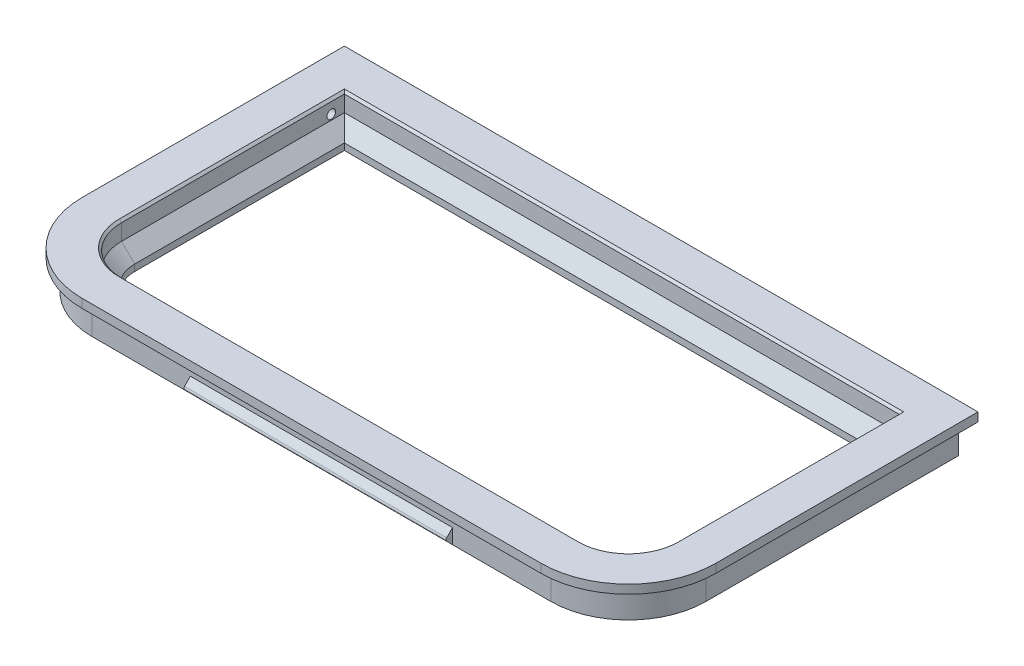
from build123d import *

# Parameters (mm, degrees)
SKETCH_1_W          = 145
SKETCH_1_H          = 80
EXTRUDE_1_DEPTH     = 2
FILLET_1_R          = 20
CUT_EXTRUDE_1_DEPTH = 2
EXTRUDE_2_DEPTH     = 2
EXTRUDE_4_DEPTH     = 7.5
EXTRUDE_5_DEPTH     = 30
FILLET_2_R          = 0.5
EXTRUDE_6_DEPTH     = 4.7
EXTRUDE_START       = -1.5
EXTRUDE_9_DEPTH     = 1.5
CHAMFER_2_SIZE      = 3
SKETCH_11_R         = 1
CUT_EXTRUDE_2_DEPTH = 149.399637803
CHAMFER_3_SIZE      = 0.5
EXTRUDE_10_DEPTH    = 60


with BuildPart() as part:
    # Эскиз1 → Бобышка-Вытянуть1 (new body)
    with BuildSketch(Plane(origin=(0, 0, 0), x_dir=(1, 0, 0), z_dir=(0, 1, 0))):
        Rectangle(SKETCH_1_W, SKETCH_1_H)
    extrude(amount=EXTRUDE_1_DEPTH)

    # Скругление1
    fillet_1_edges = [part.edges().sort_by_distance(p)[0] for p in [
        (72.5, 1, 40),
        (-72.5, 1, 40),
    ]]
    fillet(fillet_1_edges, radius=FILLET_1_R)

    # Эскиз2 → Вырез-Вытянуть1 (cut)
    with BuildSketch(Plane(origin=(0, 2, 0), x_dir=(1, 0, 0), z_dir=(0, 1, 0))):
        with BuildLine():
            Line((-63.5, 31), (-63.5, -20))
            ThreePointArc((-63.5, -20), (-60.278174593, -27.778174593), (-52.5, -31))
            Line((-52.5, -31), (52.5, -31))
            ThreePointArc((52.5, -31), (60.278174593, -27.778174593), (63.5, -20))
            Line((63.5, -20), (63.5, 31))
            Line((63.5, 31), (-63.5, 31))
        make_face()
    extrude(amount=-CUT_EXTRUDE_1_DEPTH, mode=Mode.SUBTRACT)

    # Эскиз3 → Бобышка-Вытянуть2 (add)
    with BuildSketch(Plane.XZ):
        with BuildLine():
            Line((70.25, -37.75), (70.25, 20))
            ThreePointArc((70.25, 20), (65.051145366, 32.551145366), (52.5, 37.75))
            Line((52.5, 37.75), (-52.5, 37.75))
            ThreePointArc((-52.5, 37.75), (-65.051145366, 32.551145366), (-70.25, 20))
            Line((-70.25, 20), (-70.25, -37.75))
            Line((-70.25, -37.75), (70.25, -37.75))
        make_face()
        with BuildLine():
            Line((-63.5, -31), (-63.5, 20))
            ThreePointArc((-63.5, 20), (-60.278174593, 27.778174593), (-52.5, 31))
            Line((-52.5, 31), (52.5, 31))
            ThreePointArc((52.5, 31), (60.278174593, 27.778174593), (63.5, 20))
            Line((63.5, 20), (63.5, -31))
            Line((63.5, -31), (-63.5, -31))
        make_face(mode=Mode.SUBTRACT)
    extrude(amount=EXTRUDE_2_DEPTH)

    # Эскиз5 → Бобышка-Вытянуть4 (add, symmetric)
    with BuildSketch(Plane(origin=(0, 0, 0), x_dir=(0, 0, -1), z_dir=(1, 0, 0))):
        Polygon((37.75, -2), (31, -2), (31, -6.7), (37.75, -6.7), (39.45, -5), (37.75, -3.3), align=None)
        Polygon((-31, -2), (-31, -6.7), (-37.75, -6.7), (-39.45, -5), (-37.75, -3.3), (-37.75, -2), align=None)
    extrude(amount=EXTRUDE_4_DEPTH, both=True)

    # Эскиз6 → Бобышка-Вытянуть5 (add, symmetric)
    with BuildSketch(Plane(origin=(0, 0, 0), x_dir=(0, 0, -1), z_dir=(1, 0, 0))):
        Polygon((-39.45, -5), (-37.75, -6.7), (-31, -6.7), (-31, -2), (-37.75, -2), (-37.75, -3.3), align=None)
    extrude(amount=EXTRUDE_5_DEPTH, both=True)

    # Скругление2
    fillet_2_edges = [part.edges().sort_by_distance(p)[0] for p in [
        (0, -5, 39.45),
        (0, -5, -39.45),
    ]]
    fillet(fillet_2_edges, radius=FILLET_2_R)

    # Эскиз7 → Бобышка-Вытянуть6 (add)
    with BuildSketch(Plane.XZ.offset(2)):
        with BuildLine():
            Line((-52.5, 31), (-30, 31))
            Line((-30, 31), (-30, 37.75))
            Line((-30, 37.75), (-52.5, 37.75))
            ThreePointArc((-52.5, 37.75), (-65.051145366, 32.551145366), (-70.25, 20))
            Line((-70.25, 20), (-70.25, -37.75))
            Line((-70.25, -37.75), (-7.5, -37.75))
            Line((-7.5, -37.75), (-7.5, -31))
            Line((-7.5, -31), (-63.5, -31))
            Line((-63.5, -31), (-63.5, 20))
            ThreePointArc((-63.5, 20), (-60.278174593, 27.778174593), (-52.5, 31))
        make_face()
        with BuildLine():
            Line((30, 31), (52.5, 31))
            ThreePointArc((52.5, 31), (60.278174593, 27.778174593), (63.5, 20))
            Line((63.5, 20), (63.5, -31))
            Line((63.5, -31), (7.5, -31))
            Line((7.5, -31), (7.5, -37.75))
            Line((7.5, -37.75), (70.25, -37.75))
            Line((70.25, -37.75), (70.25, 20))
            ThreePointArc((70.25, 20), (65.051145366, 32.551145366), (52.5, 37.75))
            Line((52.5, 37.75), (30, 37.75))
            Line((30, 37.75), (30, 31))
        make_face()
    extrude(amount=EXTRUDE_6_DEPTH)

    # Эскиз10 → Бобышка-Вытянуть9 (add)
    with BuildSketch(Plane.XZ.offset(6.7).offset(EXTRUDE_START)):
        with BuildLine():
            Line((-63.5, 20), (-63.5, -31))
            Line((-63.5, -31), (63.5, -31))
            Line((63.5, -31), (63.5, 20))
            ThreePointArc((63.5, 20), (60.278174593, 27.778174593), (52.5, 31))
            Line((52.5, 31), (-52.5, 31))
            ThreePointArc((-52.5, 31), (-60.278174593, 27.778174593), (-63.5, 20))
        make_face()
        with BuildLine():
            Line((60.5, -28), (60.5, 20))
            ThreePointArc((60.5, 20), (58.156854249, 25.656854249), (52.5, 28))
            Line((52.5, 28), (-52.5, 28))
            ThreePointArc((-52.5, 28), (-58.156854249, 25.656854249), (-60.5, 20))
            Line((-60.5, 20), (-60.5, -28))
            Line((-60.5, -28), (60.5, -28))
        make_face(mode=Mode.SUBTRACT)
    extrude(amount=EXTRUDE_9_DEPTH)

    # Фаска2
    chamfer_2_edges = [part.edges().sort_by_distance(p)[0] for p in [
        (-60.278174593, -5.2, 27.778174593),
        (0, -5.2, 31),
        (60.278174593, -5.2, 27.778174593),
        (63.5, -5.2, -5.5),
        (0, -5.2, -31),
        (-63.5, -5.2, -5.5),
    ]]
    chamfer(chamfer_2_edges, length=CHAMFER_2_SIZE - 0.0001)  # a hair under: the kernel refuses the full size

    # Эскиз11 → Вырез-Вытянуть2 (cut, through all)
    with BuildSketch(Plane(origin=(70.25, 0, 0), x_dir=(0, 0, -1), z_dir=(1, 0, 0))):
        with Locations((28, -1)):
            Circle(SKETCH_11_R)
    extrude(amount=-CUT_EXTRUDE_2_DEPTH, mode=Mode.SUBTRACT)

    # Фаска3
    chamfer_3_edges = [part.edges().sort_by_distance(p)[0] for p in [
        (0, 2, -31),
        (-63.5, 2, -5.5),
        (-60.278174593, 2, 27.778174593),
        (0, 2, 31),
        (60.278174593, 2, 27.778174593),
        (63.5, 2, -5.5),
    ]]
    chamfer(chamfer_3_edges, length=CHAMFER_3_SIZE)

    # Эскиз12 → Бобышка-Вытянуть10 (add, symmetric)
    with BuildSketch(Plane(origin=(0, 0, 0), x_dir=(0, 0, -1), z_dir=(1, 0, 0))):
        with BuildLine():
            Line((39.096446609, -4.646446609), (37.75, -3.3))
            Line((37.75, -3.3), (37.75, -6.7))
            Line((37.75, -6.7), (39.096446609, -5.353553391))
            ThreePointArc((39.096446609, -5.353553391), (39.242893219, -5), (39.096446609, -4.646446609))
        make_face()
    extrude(amount=EXTRUDE_10_DEPTH, both=True)


solid = part.part
